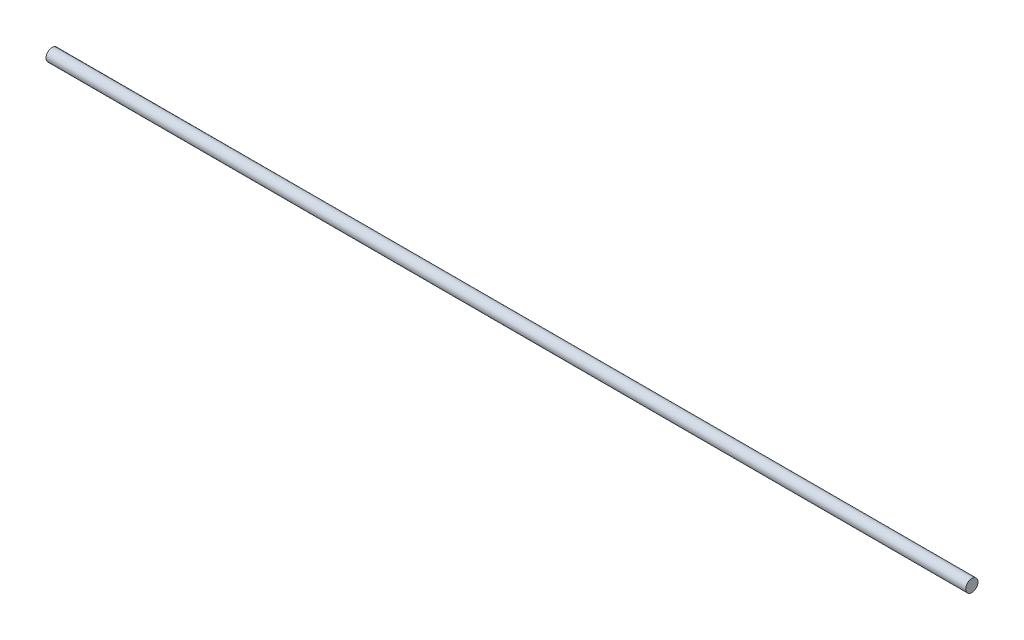
from build123d import *

# Parameters (mm, degrees)
SKETCH1_R           = 2
BOSS_EXTRUDE1_DEPTH = 149.987


with BuildPart() as part:
    # Sketch1 → Boss-Extrude1 (new, symmetric)
    with BuildSketch(Plane(origin=(0, 0, 0), x_dir=(0, 0, -1), z_dir=(1, 0, 0))):
        Circle(SKETCH1_R)
    extrude(amount=BOSS_EXTRUDE1_DEPTH, both=True)


solid = part.part
